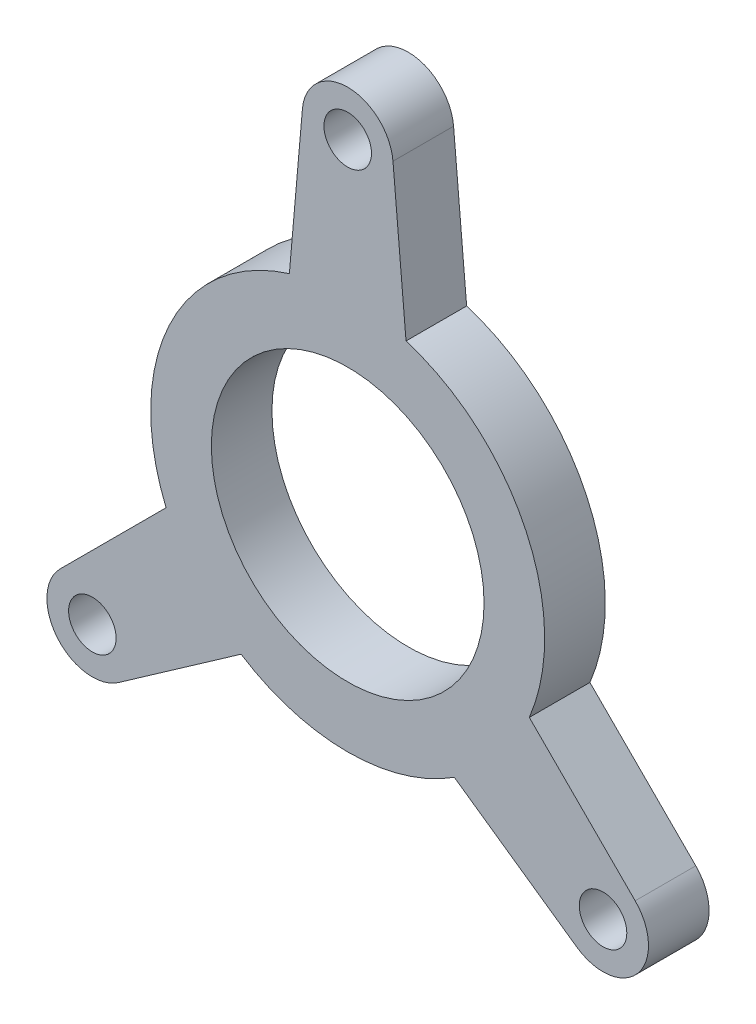
from build123d import *

# Parameters (mm, degrees)
SKETCH1_R           = 2.4892
SKETCH1_R_2         = 14.2875
BOSS_EXTRUDE1_DEPTH = 3.175


with BuildPart() as part:
    # Sketch1 → Boss-Extrude1 (new, symmetric)
    with BuildSketch(Plane.XY):
        with BuildLine():
            Line((6.111677291, 19.711768235), (4.74437725, 35.340079225))
            ThreePointArc((4.74437725, 35.340079225), (0, 39.6875), (-4.74437725, 35.340079225))
            Line((-4.74437725, 35.340079225), (-6.111677291, 19.711768235))
            ThreePointArc((-6.111677291, 19.711768235), (-18.703926955, 8.721784377), (-19.028600957, -7.988663959))
            Line((-19.028600957, -7.988663959), (-30.121698221, -19.081761223))
            ThreePointArc((-30.121698221, -19.081761223), (-30.402388836, -25.510633259), (-24.022444398, -26.350568879))
            Line((-24.022444398, -26.350568879), (-11.171580083, -17.352296813))
            ThreePointArc((-11.171580083, -17.352296813), (0, -20.6375), (11.171580083, -17.352296813))
            Line((11.171580083, -17.352296813), (24.022444398, -26.350568879))
            ThreePointArc((24.022444398, -26.350568879), (30.402388836, -25.510633259), (30.121698221, -19.081761223))
            Line((30.121698221, -19.081761223), (19.028600957, -7.988663959))
            ThreePointArc((19.028600957, -7.988663959), (18.703926955, 8.721784377), (6.111677291, 19.711768235))
        make_face()
        with Locations((0, 34.925)):
            Circle(SKETCH1_R, mode=Mode.SUBTRACT)
        Circle(SKETCH1_R_2, mode=Mode.SUBTRACT)
        with Locations((26.754102176, -22.449357268)):
            Circle(SKETCH1_R, mode=Mode.SUBTRACT)
        with Locations((-26.754102176, -22.449357268)):
            Circle(SKETCH1_R, mode=Mode.SUBTRACT)
    extrude(amount=BOSS_EXTRUDE1_DEPTH, both=True)


solid = part.part
